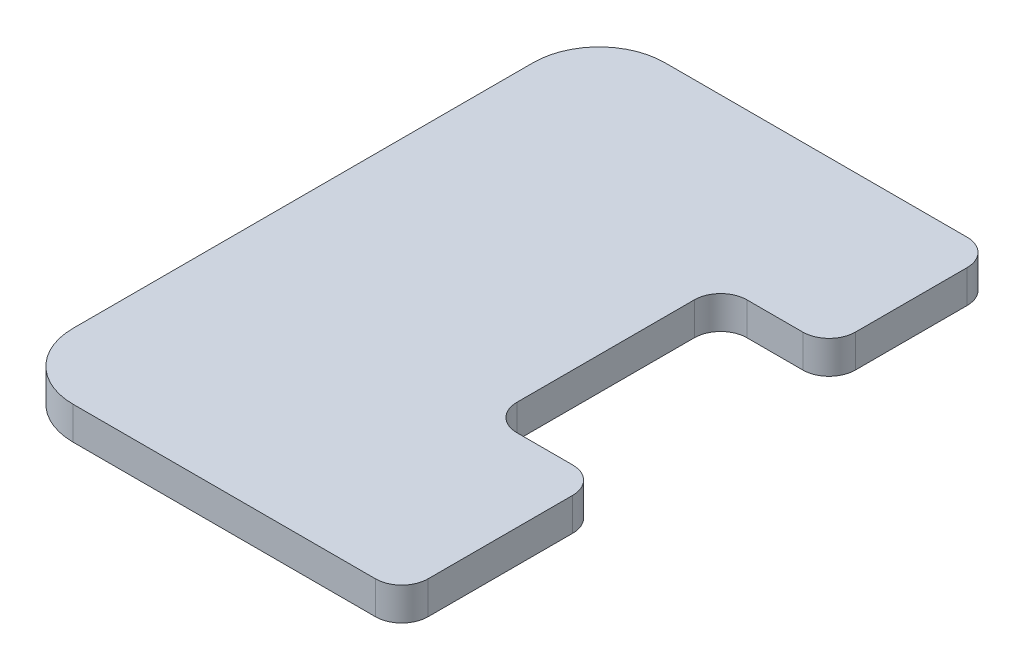
from build123d import *

# Parameters (mm, degrees)
SKETCH1_W           = 38.1
SKETCH1_H           = 57.15
BOSS_EXTRUDE1_DEPTH = 3.175
SKETCH2_W           = 10.4775
SKETCH2_H           = 22.225
CUT_EXTRUDE2_DEPTH  = 35.48932806
FILLET1_R           = 2.54
FILLET2_R           = 6.35


with BuildPart() as part:
    # Sketch1 → Boss-Extrude1 (new body)
    with BuildSketch(Plane(origin=(0, 0, 0), x_dir=(1, 0, 0), z_dir=(0, 1, 0))):
        Rectangle(SKETCH1_W, SKETCH1_H)
    extrude(amount=BOSS_EXTRUDE1_DEPTH)

    # Sketch2 → Cut-Extrude2 (cut, through all)
    with BuildSketch(Plane(origin=(0, 3.175, 0), x_dir=(1, 0, 0), z_dir=(0, 1, 0))):
        with Locations((13.81125, 1.5875)):
            Rectangle(SKETCH2_W, SKETCH2_H)
    extrude(amount=-CUT_EXTRUDE2_DEPTH, mode=Mode.SUBTRACT)

    # Fillet1
    fillet1_edges = [part.edges().sort_by_distance(p)[0] for p in [
        (19.05, 1.5875, 28.575),
        (19.05, 1.5875, -28.575),
        (19.05, 1.5875, 9.525),
        (8.5725, 1.5875, 9.525),
        (19.05, 1.5875, -12.7),
        (8.5725, 1.5875, -12.7),
    ]]
    fillet(fillet1_edges, radius=FILLET1_R)

    # Fillet2
    fillet2_edges = [part.edges().sort_by_distance(p)[0] for p in [
        (-19.05, 1.5875, 28.575),
        (-19.05, 1.5875, -28.575),
    ]]
    fillet(fillet2_edges, radius=FILLET2_R)


solid = part.part
